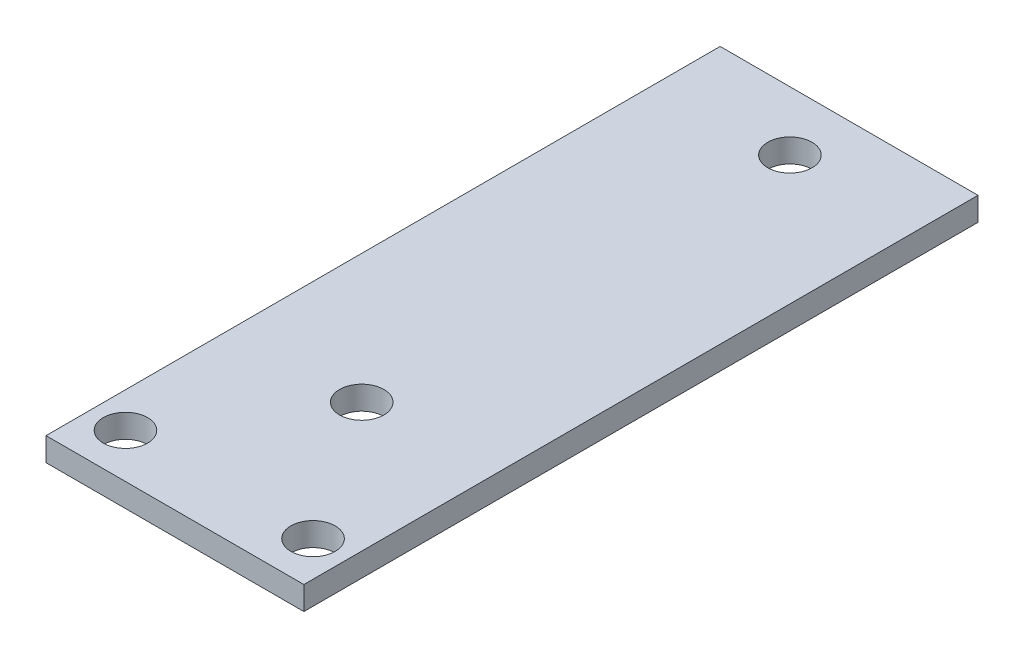
from build123d import *

# Parameters (mm, degrees)
SKETCH1_W           = 38.1
SKETCH1_H           = 120
BOSS_EXTRUDE1_DEPTH = 38.1
SKETCH2_W           = 34.925
SKETCH2_H           = 34.925
CUT_EXTRUDE1_DEPTH  = 130.767142413
SKETCH18_W          = 3.175
SKETCH18_H          = 3.175
CUT_EXTRUDE3_DEPTH  = 130.767142413
SKETCH19_R          = 3
CUT_EXTRUDE4_DEPTH  = 121.228267267
SKETCH20_W          = 34.925
SKETCH20_H          = 5
CUT_EXTRUDE5_DEPTH  = 121.228267267
SKETCH21_W          = 34.925
SKETCH21_H          = 23.7
CUT_EXTRUDE6_DEPTH  = 121.228267267


with BuildPart() as part:
    # Sketch1 → Boss-Extrude1 (new body)
    with BuildSketch(Plane.XZ.offset(34.925)):
        with Locations((15.875, -55)):
            Rectangle(SKETCH1_W, SKETCH1_H)
    extrude(amount=-BOSS_EXTRUDE1_DEPTH)

    # Sketch2 → Cut-Extrude1 (cut, through all)
    with BuildSketch(Plane(origin=(0, 0, -115), x_dir=(-1, 0, 0), z_dir=(0, 0, -1))):
        with Locations((-17.4625, -17.4625)):
            Rectangle(SKETCH2_W, SKETCH2_H)
    extrude(amount=-CUT_EXTRUDE1_DEPTH, mode=Mode.SUBTRACT)

    # Sketch18 → Cut-Extrude3 (cut, through all)
    with BuildSketch(Plane.XY.offset(5)):
        with Locations((-1.5875, 1.5875)):
            Rectangle(SKETCH18_W, SKETCH18_H)
    extrude(amount=-CUT_EXTRUDE3_DEPTH, mode=Mode.SUBTRACT)


with BuildPart() as body_2:
    # of the pieces the cut leaves, the one that is kept (cut_extrude3_keep)
    add(part.part.solids().sort_by_distance((34.925, 0, -115))[0])

    # Sketch19 → Cut-Extrude4 (cut, through all)
    with BuildSketch(Plane.XZ):
        with Locations((4.7625, -6)):
            Circle(SKETCH19_R)
        with Locations((30.1625, -6)):
            Circle(SKETCH19_R)
        with Locations((17.4625, -83.29)):
            Circle(SKETCH19_R)
        with Locations((17.4625, -25.3)):
            Circle(SKETCH19_R)
    extrude(amount=-CUT_EXTRUDE4_DEPTH, mode=Mode.SUBTRACT)

    # Sketch20 → Cut-Extrude5 (cut, through all)
    with BuildSketch(Plane.XZ):
        with Locations((17.4625, 2.5)):
            Rectangle(SKETCH20_W, SKETCH20_H)
    extrude(amount=-CUT_EXTRUDE5_DEPTH, mode=Mode.SUBTRACT)

    # Sketch21 → Cut-Extrude6 (cut, through all)
    with BuildSketch(Plane.XZ):
        with Locations((17.4625, -103.15)):
            Rectangle(SKETCH21_W, SKETCH21_H)
    extrude(amount=-CUT_EXTRUDE6_DEPTH, mode=Mode.SUBTRACT)


solid = body_2.part
